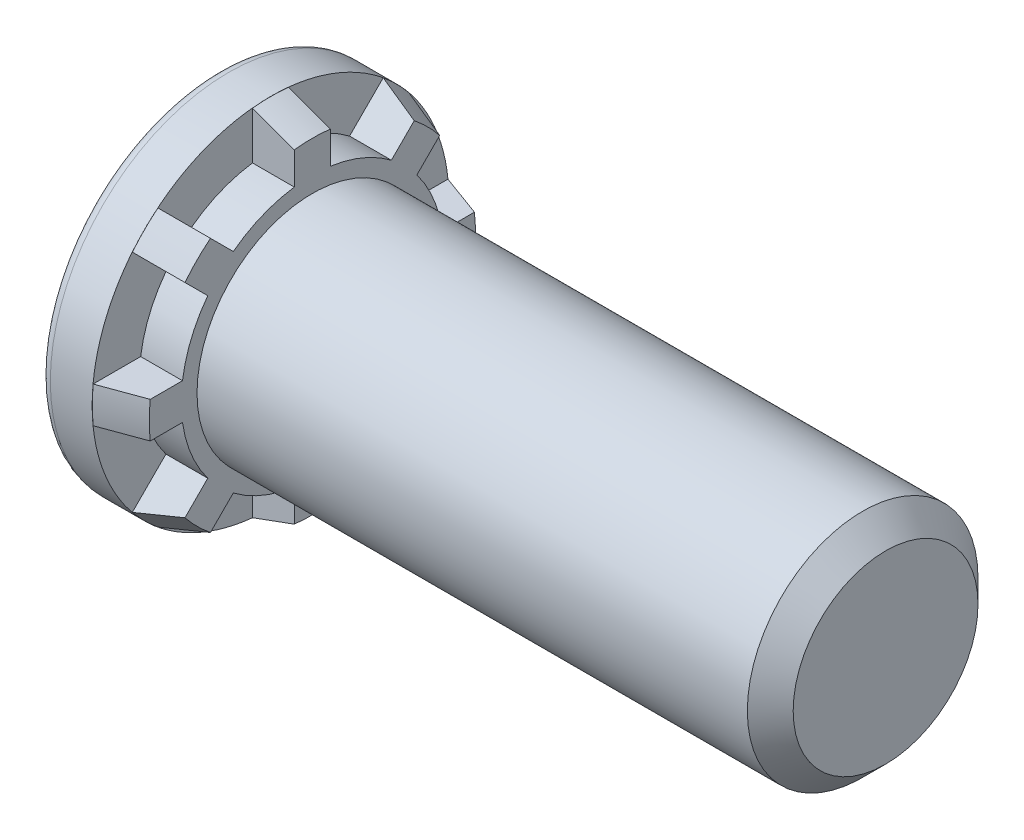
from build123d import *

# Parameters (mm, degrees)
RIBCUT_START     = -1.7272
RIBCUT_DEPTH     = 1.7272
RIBCUTSPAT_COUNT = 8
RIBCUTSPAT_ANGLE = 315


with BuildPart() as part:
    # BodySke → BaseBody (revolve)
    with BuildSketch(Plane.XY):
        with BuildLine():
            Line((-2.159, 6.9342), (-2.159, 0))
            Line((-2.159, 0), (25.4, 0))
            Line((25.4, 0), (25.4, 3.81635))
            Line((25.4, 3.81635), (24.45385, 4.7625))
            Line((24.45385, 4.7625), (1.7272, 4.7625))
            Line((1.7272, 4.7625), (1.7272, 6.735735096))
            Line((1.7272, 6.735735096), (0.00254, 7.36346))
            Line((0.00254, 7.36346), (0, 7.36346))
            Line((0, 7.36346), (0, 7.366))
            Line((0, 7.366), (-1.7272, 7.366))
            ThreePointArc((-1.7272, 7.366), (-2.032528708, 7.239528708), (-2.159, 6.9342))
        make_face()
    revolve(axis=Axis((0, 0, 0), (1, 0, 0)))

    # RibCutSke → RibCut (cut)
    with BuildSketch(Plane(origin=(1.7272, 1.794401132, -0.090952894), x_dir=(0, 0, -1), z_dir=(1, 0, 0)).offset(RIBCUT_START)):
        with BuildLine():
            Line((0.654066246, 3.567461918), (0.654066246, 5.533825289))
            ThreePointArc((0.654066246, 5.533825289), (2.727893269, 5.010895504), (4.564077617, 3.91424555))
            Line((4.564077617, 3.91424555), (3.173648743, 2.523816676))
            ThreePointArc((3.173648743, 2.523816676), (1.980656032, 3.206905232), (0.654066246, 3.567461918))
        make_face()
    ribcut = extrude(amount=RIBCUT_DEPTH, mode=Mode.SUBTRACT)

    # RibCutsPat: RibCut ×8 about axis
    ribcutspat_axis = Axis((0, 0, 0), (1, 0, 0))
    for i in range(1, RIBCUTSPAT_COUNT):
        add(ribcut.rotate(ribcutspat_axis, i * RIBCUTSPAT_ANGLE / (RIBCUTSPAT_COUNT - 1)), mode=Mode.SUBTRACT)


solid = part.part
